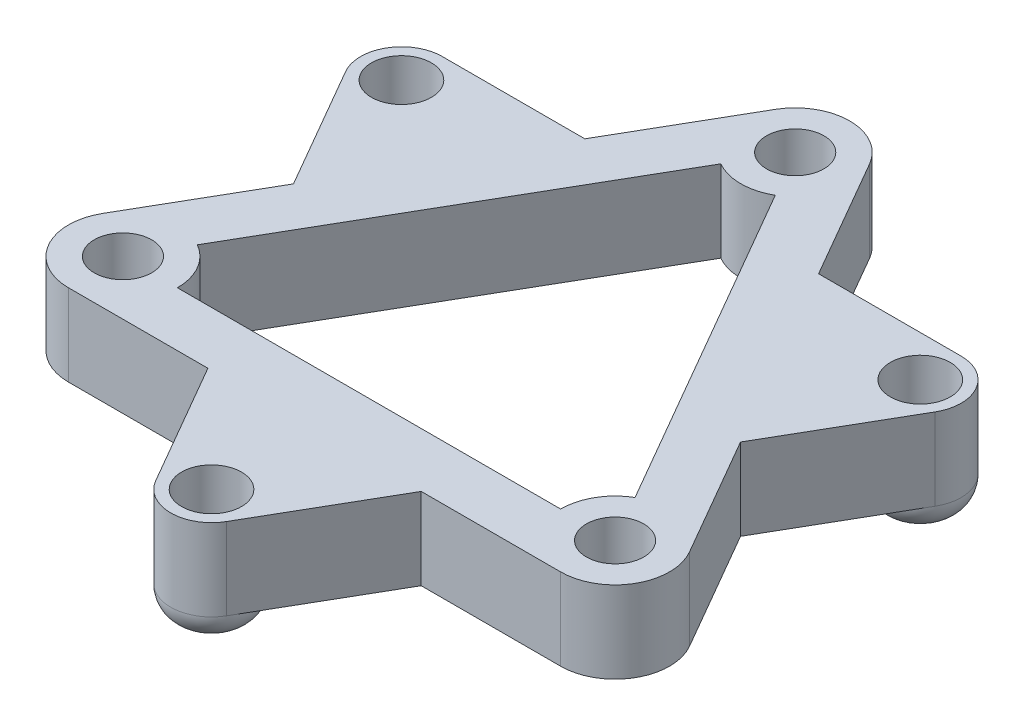
from build123d import *

# Parameters (mm, degrees)
SKETCH1_R           = 1.054
BOSS_EXTRUDE1_DEPTH = 3
SKETCH3_R           = 1.1
BOSS_EXTRUDE2_DEPTH = 3
CUT_EXTRUDE1_DEPTH  = 23.736281859
SKETCH4_R           = 1.5
BOSS_EXTRUDE3_DEPTH = 1
FILLET1_R           = 1


with BuildPart() as part:
    # Sketch1 → Boss-Extrude1 (new body)
    with BuildSketch(Plane(origin=(0, 0, 0), x_dir=(1, 0, 0), z_dir=(0, 1, 0))):
        with BuildLine():
            Line((0, 0), (9.035898385, 0))
            ThreePointArc((9.035898385, 0), (10.767949192, 1), (10.767949192, 3))
            Line((10.767949192, 3), (1.732050808, 18.650635095))
            ThreePointArc((1.732050808, 18.650635095), (0, 19.650635095), (-1.732050808, 18.650635095))
            Line((-1.732050808, 18.650635095), (-10.767949192, 3))
            ThreePointArc((-10.767949192, 3), (-10.767949192, 1), (-9.035898385, 0))
            Line((-9.035898385, 0), (0, 0))
        make_face()
        with Locations(Location((0, 17.650635095, 0), (0, 0, 270))):
            Circle(SKETCH1_R, mode=Mode.SUBTRACT)
        with Locations(Location((-9.035898385, 2, 0), (0, 0, 270))):
            Circle(SKETCH1_R, mode=Mode.SUBTRACT)
        with Locations(Location((9.035898385, 2, 0), (0, 0, 270))):
            Circle(SKETCH1_R, mode=Mode.SUBTRACT)
    extrude(amount=BOSS_EXTRUDE1_DEPTH)

    # Sketch3 → Boss-Extrude2 (add)
    with BuildSketch(Plane(origin=(0, 3, 0), x_dir=(1, 0, 0), z_dir=(0, 1, 0))):
        with BuildLine():
            Line((-9.526279442, 14.216878365), (9.526279442, 14.216878365))
            ThreePointArc((9.526279442, 14.216878365), (10.825317547, 13.466878365), (10.825317547, 11.966878365))
            Line((10.825317547, 11.966878365), (1.299038106, -4.533121635))
            ThreePointArc((1.299038106, -4.533121635), (0, -5.283121635), (-1.299038106, -4.533121635))
            Line((-1.299038106, -4.533121635), (-10.825317547, 11.966878365))
            ThreePointArc((-10.825317547, 11.966878365), (-10.825317547, 13.466878365), (-9.526279442, 14.216878365))
        make_face()
        with Locations(Location((0, -3.783121635, 0), (0, 0, 270))):
            Circle(SKETCH3_R, mode=Mode.SUBTRACT)
        with Locations(Location((-9.526279442, 12.716878365, 0), (0, 0, 270))):
            Circle(SKETCH3_R, mode=Mode.SUBTRACT)
        with Locations(Location((9.526279442, 12.716878365, 0), (0, 0, 270))):
            Circle(SKETCH3_R, mode=Mode.SUBTRACT)
    extrude(amount=-BOSS_EXTRUDE2_DEPTH)

    # Sketch2 → Cut-Extrude1 (cut, through all)
    with BuildSketch(Plane(origin=(0, 3, 0), x_dir=(1, 0, 0), z_dir=(0, 1, 0))):
        with BuildLine():
            Line((-1, 15.918584287), (-8.035898385, 3.732050808))
            ThreePointArc((-8.035898385, 3.732050808), (-7.303847577, 3), (-7.035898385, 2))
            Line((-7.035898385, 2), (7.035898385, 2))
            ThreePointArc((7.035898385, 2), (7.303847577, 3), (8.035898385, 3.732050808))
            Line((8.035898385, 3.732050808), (1, 15.918584287))
            ThreePointArc((1, 15.918584287), (0, 15.650635095), (-1, 15.918584287))
        make_face()
    extrude(amount=-CUT_EXTRUDE1_DEPTH, mode=Mode.SUBTRACT)

    # Sketch4 → Boss-Extrude3 (add)
    with BuildSketch(Plane.XZ):
        with Locations(Location((0, 3.783121635, 0), (0, 0, 30))):
            Circle(SKETCH4_R)
        with Locations(Location((9.526279442, -12.716878365, 0), (0, 0, 270))):
            Circle(SKETCH4_R)
        with Locations(Location((-9.526279442, -12.716878365, 0), (0, 0, 270))):
            Circle(SKETCH4_R)
    extrude(amount=BOSS_EXTRUDE3_DEPTH)

    # Fillet1
    fillet1_edges = [part.edges().sort_by_distance(p)[0] for p in [
        (-1.299038106, -1, 3.033121635),
        (9.526279442, -1, -11.216878365),
        (-9.526279442, -1, -11.216878365),
    ]]
    fillet(fillet1_edges, radius=FILLET1_R - 0.0001)  # a hair under: the kernel refuses the full size


solid = part.part
